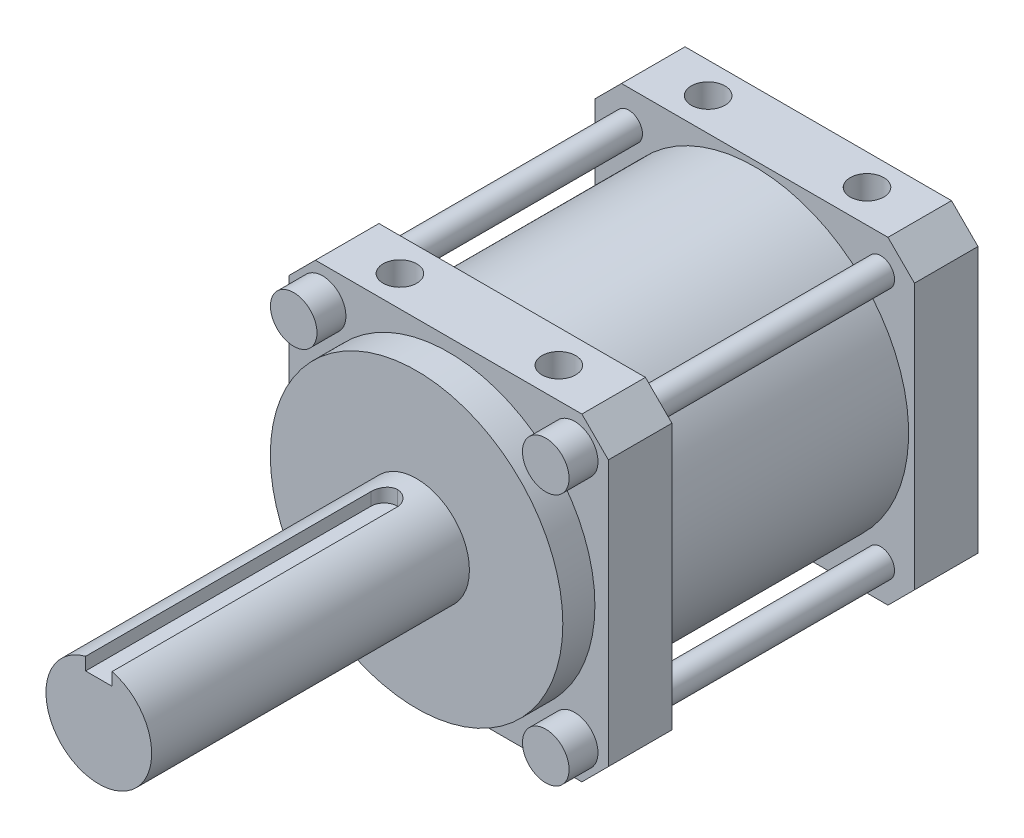
from build123d import *

# Parameters (mm, degrees)
SKETCH1_R                       = 18.4531
CAN_DEPTH                       = 14.5415
SKETCH2_W                       = 38.3032
SKETCH2_H                       = 38.2016
FRONT_FLANGE_DEPTH              = 7.62
SKETCH3_R                       = 17.5387
FRONT_BEARING_DEPTH             = 3.8481
SKETCH4_R                       = 6.3373
SHAFT_DEPTH                     = 38.1
KEYWAY_START                    = -35.814
KEYWAY_DEPTH                    = 35.814
SKETCH7_R                       = 2.794
SCREW_HEADS_DEPTH               = 3.4671
SKETCH8_R                       = 1.651
SCREW_THREADS_DEPTH             = 36.703
F_10_32_TAPPED_HOLE1_AT_2_COUNT = 2
F_10_32_TAPPED_HOLE1_AT_2_PITCH = 19.05
F_10_32_TAPPED_HOLE1_AT_3_COUNT = 2
F_10_32_TAPPED_HOLE1_AT_3_PITCH = 41.577906982
F_10_32_TAPPED_HOLE1_AT_4_COUNT = 2
F_10_32_TAPPED_HOLE1_AT_4_PITCH = 36.957
SKETCH12_R                      = 8.763
BACK_RECESS_DEPTH               = 6.35
SKETCH13_R                      = 3.175
PINION_RECESS_DEPTH             = 9.398
FLANGE_CHAMFERS_SIZE            = 3.175
KEYWAY_FILLET_R                 = 1.5875


with BuildPart() as part:
    # Sketch1 → Can (new, symmetric)
    with BuildSketch(Plane.XY):
        with Locations(Location((0, 0, 0), (0, 0, 180))):
            Circle(SKETCH1_R)
    extrude(amount=CAN_DEPTH, both=True)

    # Sketch2 → Front Flange (add)
    with BuildSketch(Plane.XY.offset(14.5415)):
        Rectangle(SKETCH2_W, SKETCH2_H)
    front_flange = extrude(amount=FRONT_FLANGE_DEPTH)

    # Sketch3 → Front Bearing (add)
    with BuildSketch(Plane.XY.offset(22.1615)):
        with Locations(Location((0, 0, 0), (0, 0, 180))):
            Circle(SKETCH3_R)
    extrude(amount=FRONT_BEARING_DEPTH)

    # Sketch4 → Shaft (add)
    with BuildSketch(Plane.XY.offset(26.0096)):
        with Locations(Location((0, 0, 0), (0, 0, 180))):
            Circle(SKETCH4_R)
    extrude(amount=SHAFT_DEPTH)

    # Sketch6 → Keyway (cut)
    with BuildSketch(Plane.XY.offset(64.1096).offset(KEYWAY_START)):
        with BuildLine():
            Line((-1.5875, 6.135243682), (-1.5875, 4.611243682))
            Line((-1.5875, 4.611243682), (1.5875, 4.611243682))
            Line((1.5875, 4.611243682), (1.5875, 6.135243682))
            ThreePointArc((1.5875, 6.135243682), (0, 6.3373), (-1.5875, 6.135243682))
        make_face()
    extrude(amount=KEYWAY_DEPTH, mode=Mode.SUBTRACT)

    # Back Flange: Front Flange across plane
    add(front_flange.mirror(Plane.XY))

    # Sketch7 → Screw Heads (add)
    with BuildSketch(Plane.XY.offset(22.1615)):
        with Locations(Location((15.113, 15.113, 0), (0, 0, 180))):
            Circle(SKETCH7_R)
        with Locations(Location((-15.113, 15.113, 0), (0, 0, 180))):
            Circle(SKETCH7_R)
        with Locations(Location((-15.113, -15.113, 0), (0, 0, 180))):
            Circle(SKETCH7_R)
        with Locations(Location((15.113, -15.113, 0), (0, 0, 180))):
            Circle(SKETCH7_R)
    extrude(amount=SCREW_HEADS_DEPTH)

    # Sketch8 → Screw Threads (add)
    with BuildSketch(Plane.XY.offset(22.1615)):
        with Locations((-15.113, 15.113)):
            Circle(SKETCH8_R)
        with Locations((15.113, 15.113)):
            Circle(SKETCH8_R)
        with Locations((15.113, -15.113)):
            Circle(SKETCH8_R)
        with Locations((-15.113, -15.113)):
            Circle(SKETCH8_R)
    extrude(amount=-SCREW_THREADS_DEPTH)

    # Sketch10 → #10-32 Tapped Hole1 (revolve, cut)
    with BuildSketch(Plane(origin=(-9.525, 19.1008, 18.4785), x_dir=(0, 0, 1), z_dir=(1, 0, 0))):
        Polygon((0, 0), (0, 7.563317848), (2.0193, 6.35), (2.0193, 0), align=None)
    f_10_32_tapped_hole1 = revolve(axis=Axis((-9.525, 25.4508, 18.4785), (0, -1, 0)), mode=Mode.SUBTRACT)

    # #10-32 Tapped Hole1 at 2: #10-32 Tapped Hole1 ×2
    with Locations(*[(i * F_10_32_TAPPED_HOLE1_AT_2_PITCH, 0, 0) for i in range(1, F_10_32_TAPPED_HOLE1_AT_2_COUNT)]):
        add(f_10_32_tapped_hole1, mode=Mode.SUBTRACT)

    # #10-32 Tapped Hole1 at 3: #10-32 Tapped Hole1 ×2
    with Locations(*[Vector(0.4581760214209039, 0, -0.8888614815565536) * (i * F_10_32_TAPPED_HOLE1_AT_3_PITCH) for i in range(1, F_10_32_TAPPED_HOLE1_AT_3_COUNT)]):
        add(f_10_32_tapped_hole1, mode=Mode.SUBTRACT)

    # #10-32 Tapped Hole1 at 4: #10-32 Tapped Hole1 ×2
    with Locations(*[(0, 0, -i * F_10_32_TAPPED_HOLE1_AT_4_PITCH) for i in range(1, F_10_32_TAPPED_HOLE1_AT_4_COUNT)]):
        add(f_10_32_tapped_hole1, mode=Mode.SUBTRACT)

    # #10-32 Tapped Hole2: #10-32 Tapped Hole1 across plane
    add(f_10_32_tapped_hole1.mirror(Plane.ZX), mode=Mode.SUBTRACT)

    # #10-32 Tapped Hole2 copy 1 sketch → #10-32 Tapped Hole2 copy 1 (revolve, cut)
    with BuildSketch(Plane(origin=(9.525, -19.1008, 18.4785), x_dir=(0, 0, 1), z_dir=(1, 0, 0))):
        Polygon((0, 0), (0, -7.563317848), (2.0193, -6.35), (2.0193, 0), align=None)
    revolve(axis=Axis((9.525, -25.4508, 18.4785), (0, -1, 0)), mode=Mode.SUBTRACT)

    # #10-32 Tapped Hole2 copy 2 sketch → #10-32 Tapped Hole2 copy 2 (revolve, cut)
    with BuildSketch(Plane(origin=(9.525, -19.1008, -18.4785), x_dir=(0, 0, 1), z_dir=(1, 0, 0))):
        Polygon((0, 0), (0, -7.563317848), (2.0193, -6.35), (2.0193, 0), align=None)
    revolve(axis=Axis((9.525, -25.4508, -18.4785), (0, -1, 0)), mode=Mode.SUBTRACT)

    # #10-32 Tapped Hole2 copy 3 sketch → #10-32 Tapped Hole2 copy 3 (revolve, cut)
    with BuildSketch(Plane(origin=(-9.525, -19.1008, -18.4785), x_dir=(0, 0, 1), z_dir=(1, 0, 0))):
        Polygon((0, 0), (0, -7.563317848), (2.0193, -6.35), (2.0193, 0), align=None)
    revolve(axis=Axis((-9.525, -25.4508, -18.4785), (0, -1, 0)), mode=Mode.SUBTRACT)

    # Sketch12 → Back Recess (cut)
    with BuildSketch(Plane(origin=(0, 0, -22.1615), x_dir=(-1, 0, 0), z_dir=(0, 0, -1))):
        Circle(SKETCH12_R)
    extrude(amount=-BACK_RECESS_DEPTH, mode=Mode.SUBTRACT)

    # Sketch13 → Pinion Recess (cut)
    with BuildSketch(Plane(origin=(0, 0, -15.8115), x_dir=(-1, 0, 0), z_dir=(0, 0, -1))):
        Circle(SKETCH13_R)
    extrude(amount=-PINION_RECESS_DEPTH, mode=Mode.SUBTRACT)

    # Flange Chamfers
    flange_chamfers_edges = [part.edges().sort_by_distance(p)[0] for p in [
        (19.1516, 19.1008, -18.3515),
        (19.1516, -19.1008, -18.3515),
        (-19.1516, -19.1008, -18.3515),
        (-19.1516, 19.1008, -18.3515),
        (19.1516, -19.1008, 18.3515),
        (19.1516, 19.1008, 18.3515),
        (-19.1516, 19.1008, 18.3515),
        (-19.1516, -19.1008, 18.3515),
    ]]
    chamfer(flange_chamfers_edges, length=FLANGE_CHAMFERS_SIZE)

    # Keyway Fillet
    keyway_fillet_edges = [part.edges().sort_by_distance(p)[0] for p in [
        (-1.5875, 5.373243682, 28.2956),
        (1.5875, 5.373243682, 28.2956),
    ]]
    fillet(keyway_fillet_edges, radius=KEYWAY_FILLET_R - 0.0001)  # a hair under: the kernel refuses the full size


solid = part.part
